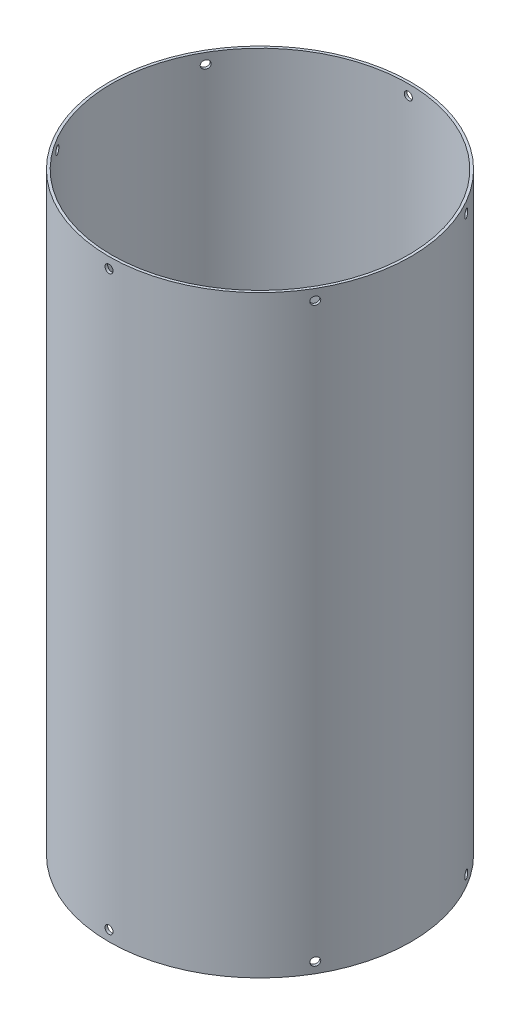
from build123d import *

# Parameters (mm, degrees)
SKETCH2_R           = 90.4875
SKETCH2_R_2         = 88.9
BOSS_EXTRUDE1_DEPTH = 355.6
SKETCH3_R           = 2.413
CUT_EXTRUDE1_DEPTH  = 378.925039277
CIRPATTERN1_COUNT   = 6


with BuildPart() as part:
    # Sketch2 → Boss-Extrude1 (new body)
    with BuildSketch(Plane(origin=(0, 0, 0), x_dir=(1, 0, 0), z_dir=(0, 1, 0))):
        Circle(SKETCH2_R)
        Circle(SKETCH2_R_2, mode=Mode.SUBTRACT)
    extrude(amount=BOSS_EXTRUDE1_DEPTH)

    # Sketch3 → Cut-Extrude1 (cut, symmetric)
    with BuildSketch(Plane.XY):
        with Locations((0, 349.25)):
            Circle(SKETCH3_R)
        with Locations((0, 6.35)):
            Circle(SKETCH3_R)
    cut_extrude1 = extrude(amount=CUT_EXTRUDE1_DEPTH, both=True, mode=Mode.SUBTRACT)

    # CirPattern1: Cut-Extrude1 ×6 about axis
    cirpattern1_axis = Axis((0, 355.6, 0), (0, 1, 0))
    for i in range(1, CIRPATTERN1_COUNT):
        add(cut_extrude1.rotate(cirpattern1_axis, i * 360 / CIRPATTERN1_COUNT), mode=Mode.SUBTRACT)


solid = part.part
